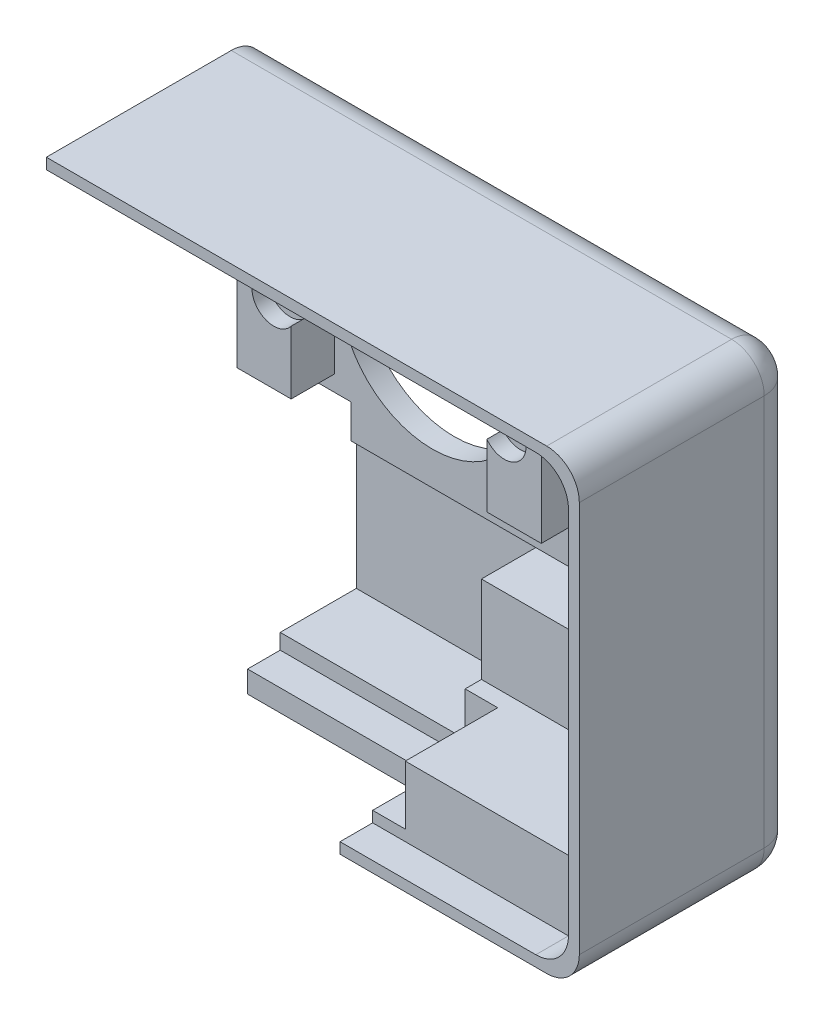
from build123d import *

# Parameters (mm, degrees)
SKETCH1_W           = 62
SKETCH1_H           = 42
BOSS_EXTRUDE1_DEPTH = 20
SKETCH8_W           = 24
SKETCH8_H           = 38
CUT_EXTRUDE1_DEPTH  = 11.5
CUT_EXTRUDE2_REACH  = 41.17
SKETCH9_R           = 8.5
SKETCH10_W          = 57
SKETCH10_H          = 23.165977038
CUT_EXTRUDE3_DEPTH  = 18
FILLET1_R           = 3
FILLET2_R           = 3
SKETCH11_W          = 18
SKETCH11_H          = 8
CUT_EXTRUDE4_DEPTH  = 8.5
SKETCH12_W          = 60
SKETCH12_H          = 40
CUT_EXTRUDE5_DEPTH  = 3
FILLET3_R           = 3
SKETCH13_W          = 18
SKETCH13_H          = 12
CUT_EXTRUDE6_DEPTH  = 7
CUT_EXTRUDE10_REACH = 44.45
SKETCH18_W          = 10.5
SKETCH18_H          = 7
SKETCH22_W          = 5
SKETCH22_H          = 14
BOSS_EXTRUDE2_DEPTH = 4
SKETCH16_R          = 2
CUT_EXTRUDE9_DEPTH  = 1.5
CHAMFER1_SIZE       = 1
SKETCH19_W          = 34
SKETCH19_H          = 1.2
CUT_EXTRUDE11_DEPTH = 16
SKETCH20_W          = 34
SKETCH20_H          = 0.717011481
CUT_EXTRUDE12_DEPTH = 10
SKETCH21_W          = 60
SKETCH21_H          = 8
CUT_EXTRUDE13_DEPTH = 10
SKETCH14_W          = 24.0014575
SKETCH14_H          = 44.120551562
CUT_EXTRUDE7_DEPTH  = 13
SKETCH15_W          = 25.642620831
SKETCH15_H          = 19.236744125
CUT_EXTRUDE8_DEPTH  = 10
SKETCH23_W          = 12
SKETCH23_H          = 0.717011481
CUT_EXTRUDE14_DEPTH = 5


with BuildPart() as part:
    # Sketch1 → Boss-Extrude1 (new body)
    with BuildSketch(Plane.XY):
        Rectangle(SKETCH1_W, SKETCH1_H)
    extrude(amount=BOSS_EXTRUDE1_DEPTH)

    # Sketch8 → Cut-Extrude1 (cut)
    with BuildSketch(Plane.XY.offset(20)):
        Rectangle(SKETCH8_W, SKETCH8_H)
    extrude(amount=-CUT_EXTRUDE1_DEPTH, mode=Mode.SUBTRACT)

    # Sketch9 → Cut-Extrude2 (cut, up to next)
    with BuildSketch(Plane.XY.offset(8.5), mode=Mode.PRIVATE) as cut_extrude2_sk1:
        with Locations((-0.494531145, 6)):
            Circle(SKETCH9_R)
    cut_extrude2_tool1 = extrude(cut_extrude2_sk1.sketch, amount=-CUT_EXTRUDE2_REACH, mode=Mode.PRIVATE) & part.part
    add(cut_extrude2_tool1.solids().sort_by_distance((-0.494531, 6, 8.5))[0], mode=Mode.SUBTRACT)

    # Sketch10 → Cut-Extrude3 (cut)
    with BuildSketch(Plane.XY.offset(20)):
        with Locations((0, 6)):
            Rectangle(SKETCH10_W, SKETCH10_H)
    extrude(amount=-CUT_EXTRUDE3_DEPTH, mode=Mode.SUBTRACT)

    # Fillet1
    fillet1_edges = [part.edges().sort_by_distance(p)[0] for p in [
        (-31, 0, 0),
        (0, -21, 0),
        (31, 0, 0),
        (0, 21, 0),
    ]]
    fillet(fillet1_edges, radius=FILLET1_R)

    # Fillet2
    # the kernel refuses this fillet: 3 mm, written as the material it takes off along each edge
    with BuildSketch(Plane(origin=(-28, 18, 3), x_dir=(-1, 0, 0), z_dir=(0, 1, 0))) as fillet2_piece_1_section:
        Polygon((0, 0), (FILLET2_R, 0), (FILLET2_R, -FILLET2_R), (0, -FILLET2_R), align=None)
    fillet2_piece_1 = extrude(amount=FILLET2_R, mode=Mode.PRIVATE)
    fillet2_piece_1 = fillet2_piece_1 - Plane(origin=(-28, 18, 3), x_dir=(0.7071067811865475, 0, 0.7071067811865475), z_dir=(0, 1, 0)) * Sphere(FILLET2_R, mode=Mode.PRIVATE)
    add(fillet2_piece_1, mode=Mode.SUBTRACT)
    with BuildSketch(Plane(origin=(-28, -18, 3), x_dir=(0, -1, 0), z_dir=(-1, 0, 0))) as fillet2_piece_2_section:
        Polygon((0, 0), (FILLET2_R, 0), (FILLET2_R, -FILLET2_R), (0, -FILLET2_R), align=None)
    fillet2_piece_2 = extrude(amount=FILLET2_R, mode=Mode.PRIVATE)
    fillet2_piece_2 = fillet2_piece_2 - Plane(origin=(-28, -18, 3), x_dir=(0, 0.7071067811865475, 0.7071067811865475), z_dir=(-1, 0, 0)) * Sphere(FILLET2_R, mode=Mode.PRIVATE)
    add(fillet2_piece_2, mode=Mode.SUBTRACT)
    with BuildSketch(Plane(origin=(28, 18, 3), x_dir=(1, 0, 0), z_dir=(0, 1, 0))) as fillet2_piece_3_section:
        Polygon((0, 0), (FILLET2_R, 0), (FILLET2_R, FILLET2_R), (0, FILLET2_R), align=None)
    fillet2_piece_3 = extrude(amount=FILLET2_R, mode=Mode.PRIVATE)
    fillet2_piece_3 = fillet2_piece_3 - Plane(origin=(28, 18, 3), x_dir=(-0.7071067811865475, 0, 0.7071067811865475), z_dir=(0, 1, 0)) * Sphere(FILLET2_R, mode=Mode.PRIVATE)
    add(fillet2_piece_3, mode=Mode.SUBTRACT)
    with BuildSketch(Plane(origin=(28, -18, 3), x_dir=(0, -1, 0), z_dir=(1, 0, 0))) as fillet2_piece_4_section:
        Polygon((0, 0), (FILLET2_R, 0), (FILLET2_R, FILLET2_R), (0, FILLET2_R), align=None)
    fillet2_piece_4 = extrude(amount=FILLET2_R, mode=Mode.PRIVATE)
    fillet2_piece_4 = fillet2_piece_4 - Plane(origin=(28, -18, 3), x_dir=(0, 0.7071067811865475, 0.7071067811865475), z_dir=(1, 0, 0)) * Sphere(FILLET2_R, mode=Mode.PRIVATE)
    add(fillet2_piece_4, mode=Mode.SUBTRACT)
    with BuildSketch(Plane(origin=(-31, 21, 3), x_dir=(1, 0, 0), z_dir=(0, 0, 1)), Plane(origin=(-31, -21, 3), x_dir=(0, 1, 0), z_dir=(0, 0, 1))) as fillet2_piece_5:
        with BuildLine():
            CenterArc((FILLET2_R, -FILLET2_R), FILLET2_R, 90, 90)
            Line((0, -FILLET2_R), (0, 0))
            Line((0, 0), (FILLET2_R, 0))
        make_face()
    extrude(amount=24.5, mode=Mode.SUBTRACT)
    with BuildSketch(Plane(origin=(31, -21, 3), x_dir=(0, 1, 0), z_dir=(0, 0, 1)), Plane(origin=(31, 21, 3), x_dir=(-1, 0, 0), z_dir=(0, 0, 1))) as fillet2_piece_6:
        with BuildLine():
            CenterArc((FILLET2_R, FILLET2_R), FILLET2_R, 180, 90)
            Line((0, FILLET2_R), (0, 0))
            Line((0, 0), (FILLET2_R, 0))
        make_face()
    extrude(amount=24.5, mode=Mode.SUBTRACT)

    # Sketch11 → Cut-Extrude4 (cut)
    with BuildSketch(Plane.XY.offset(20)):
        with Locations((0, -17)):
            Rectangle(SKETCH11_W, SKETCH11_H)
    extrude(amount=-CUT_EXTRUDE4_DEPTH, mode=Mode.SUBTRACT)

    # Sketch12 → Cut-Extrude5 (cut)
    with BuildSketch(Plane.XY.offset(20)):
        Rectangle(SKETCH12_W, SKETCH12_H)
    extrude(amount=-CUT_EXTRUDE5_DEPTH, mode=Mode.SUBTRACT)

    # Fillet3
    fillet3_edges = [part.edges().sort_by_distance(p)[0] for p in [
        (30, -20, 18.5),
        (-30, -20, 18.5),
        (-30, 20, 18.5),
        (30, 20, 18.5),
    ]]
    fillet(fillet3_edges, radius=FILLET3_R)

    # Sketch13 → Cut-Extrude6 (cut)
    with BuildSketch(Plane.XY.offset(8.5)):
        with Locations((0, -11.582988519)):
            Rectangle(SKETCH13_W, SKETCH13_H)
    extrude(amount=-CUT_EXTRUDE6_DEPTH, mode=Mode.SUBTRACT)

    # Sketch18 → Cut-Extrude10 (cut, up to next)
    with BuildSketch(Plane(origin=(0, 0, 0), x_dir=(-1, 0, 0), z_dir=(0, 0, -1)), mode=Mode.PRIVATE) as cut_extrude10_sk1:
        with Locations((-19.755468855, 6)):
            Rectangle(SKETCH18_W, SKETCH18_H)
    cut_extrude10_tool1 = extrude(cut_extrude10_sk1.sketch, amount=-CUT_EXTRUDE10_REACH, mode=Mode.PRIVATE) & part.part
    # Sketch18 → Cut-Extrude10 (cut, up to next)
    with BuildSketch(Plane(origin=(0, 0, 0), x_dir=(-1, 0, 0), z_dir=(0, 0, -1)), mode=Mode.PRIVATE) as cut_extrude10_sk2:
        with Locations((20.744531145, 6)):
            Rectangle(SKETCH18_W, SKETCH18_H)
    cut_extrude10_tool2 = extrude(cut_extrude10_sk2.sketch, amount=-CUT_EXTRUDE10_REACH, mode=Mode.PRIVATE) & part.part
    add(cut_extrude10_tool1.solids().sort_by_distance((19.755469, 6, 0))[0], mode=Mode.SUBTRACT)
    add(cut_extrude10_tool2.solids().sort_by_distance((-20.744531, 6, 0))[0], mode=Mode.SUBTRACT)

    # Sketch22 → Boss-Extrude2 (add)
    with BuildSketch(Plane.XY.offset(2)):
        with Locations((-11.994531145, 6)):
            Rectangle(SKETCH22_W, SKETCH22_H)
        with Locations((11.005468855, 6)):
            Rectangle(SKETCH22_W, SKETCH22_H)
    extrude(amount=BOSS_EXTRUDE2_DEPTH)

    # Sketch16 → Cut-Extrude9 (cut)
    with BuildSketch(Plane.XY.offset(6)):
        with Locations((-11.094531145, 6)):
            Circle(SKETCH16_R)
        with Locations((10.105468855, 6)):
            Circle(SKETCH16_R)
    extrude(amount=-CUT_EXTRUDE9_DEPTH, mode=Mode.SUBTRACT)

    # Chamfer1
    chamfer1_edges = [part.edges().sort_by_distance(p)[0] for p in [
        (25.005468855, 6, 0),
        (19.755468855, 2.5, 0),
        (14.505468855, 6, 0),
        (19.755468855, 9.5, 0),
        (-15.494531145, 6, 0),
        (-20.744531145, 2.5, 0),
        (-25.994531145, 6, 0),
        (-20.744531145, 9.5, 0),
    ]]
    chamfer(chamfer1_edges, length=CHAMFER1_SIZE)

    # Sketch19 → Cut-Extrude11 (cut)
    with BuildSketch(Plane.XY.offset(17)):
        with Locations((0.034121004, 18.9)):
            Rectangle(SKETCH19_W, SKETCH19_H)
    extrude(amount=-CUT_EXTRUDE11_DEPTH, mode=Mode.SUBTRACT)

    # Sketch20 → Cut-Extrude12 (cut)
    with BuildSketch(Plane.XY.offset(17)):
        with Locations((0.034121004, 17.94149426)):
            Rectangle(SKETCH20_W, SKETCH20_H)
    extrude(amount=-CUT_EXTRUDE12_DEPTH, mode=Mode.SUBTRACT)

    # Sketch21 → Cut-Extrude13 (cut)
    with BuildSketch(Plane.XY.offset(17)):
        with Locations((0, -9.582988519)):
            Rectangle(SKETCH21_W, SKETCH21_H)
    extrude(amount=-CUT_EXTRUDE13_DEPTH, mode=Mode.SUBTRACT)

    # Sketch14 → Cut-Extrude7 (cut)
    with BuildSketch(Plane.ZY.offset(31)):
        with Locations((10.285512598, -0.436155296)):
            Rectangle(SKETCH14_W, SKETCH14_H)
    extrude(amount=-CUT_EXTRUDE7_DEPTH, mode=Mode.SUBTRACT)

    # Sketch15 → Cut-Extrude8 (cut)
    with BuildSketch(Plane.ZY.offset(18)):
        with Locations((10.646983425, -12.09757059)):
            Rectangle(SKETCH15_W, SKETCH15_H)
    extrude(amount=-CUT_EXTRUDE8_DEPTH, mode=Mode.SUBTRACT)

    # Sketch23 → Cut-Extrude14 (cut)
    with BuildSketch(Plane.XY.offset(7)):
        with Locations((-10.965878996, 17.94149426)):
            Rectangle(SKETCH23_W, SKETCH23_H)
    extrude(amount=-CUT_EXTRUDE14_DEPTH, mode=Mode.SUBTRACT)


solid = part.part
